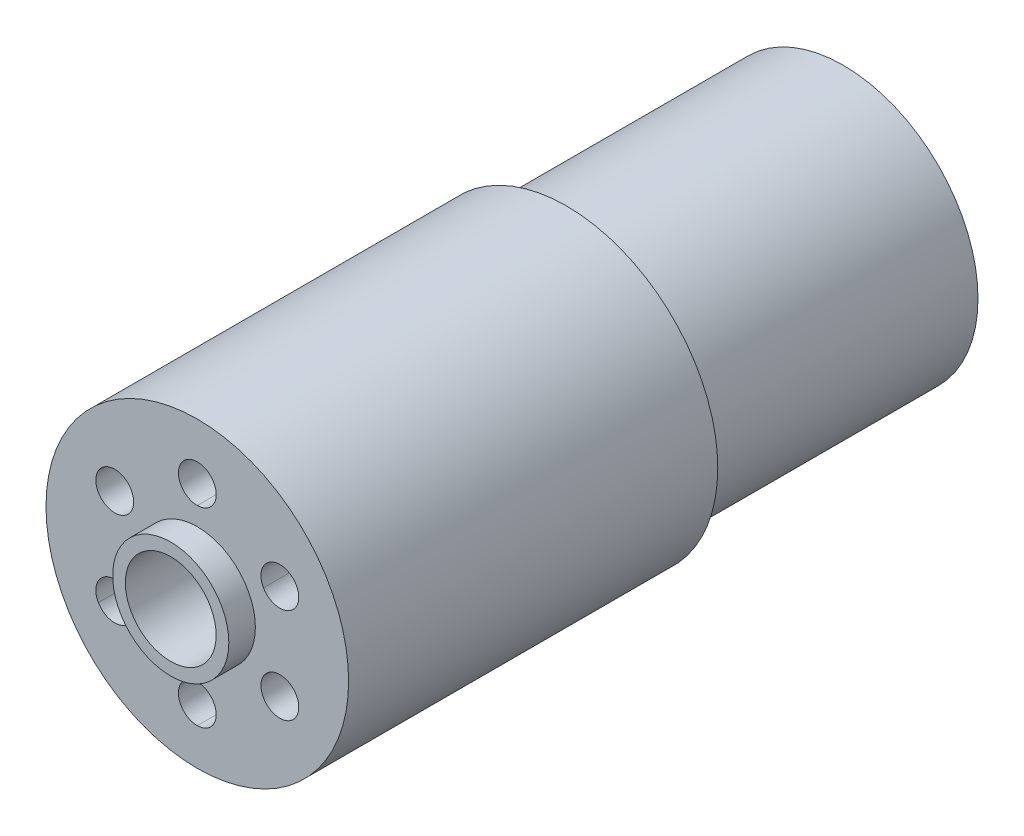
from build123d import *

# Parameters (mm, degrees)
SKETCH1_R           = 25.4
BOSS_EXTRUDE2_DEPTH = 108.458
SKETCH6_R           = 7.62
SKETCH6_R_2         = 3.175
CUT_EXTRUDE1_DEPTH  = 108.458
SKETCH7_R           = 25.4
SKETCH7_R_2         = 22.606
CUT_EXTRUDE2_DEPTH  = 46.482
SKETCH8_R           = 9.75
SKETCH8_R_2         = 7.62
BOSS_EXTRUDE7_DEPTH = 4.4577
BOSS_EXTRUDE8_START = 4.4577
SKETCH9_R           = 9.75
SKETCH9_R_2         = 7.62
BOSS_EXTRUDE8_DEPTH = 4.4577


with BuildPart() as part:
    # Sketch1 → Boss-Extrude2 (new body)
    with BuildSketch(Plane.XY):
        Circle(SKETCH1_R)
    extrude(amount=BOSS_EXTRUDE2_DEPTH)

    # Sketch6 → Cut-Extrude1 (cut)
    with BuildSketch(Plane(origin=(0, 0, 0), x_dir=(-1, 0, 0), z_dir=(0, 0, -1))):
        Circle(SKETCH6_R)
        with Locations((-13.858138511, 8.001)):
            Circle(SKETCH6_R_2)
        with Locations((0, 16.002)):
            Circle(SKETCH6_R_2)
        with Locations((13.858138511, 8.001)):
            Circle(SKETCH6_R_2)
        with Locations((13.858138511, -8.001)):
            Circle(SKETCH6_R_2)
        with Locations((0, -16.002)):
            Circle(SKETCH6_R_2)
        with Locations((-13.858138511, -8.001)):
            Circle(SKETCH6_R_2)
    extrude(amount=-CUT_EXTRUDE1_DEPTH, mode=Mode.SUBTRACT)

    # Sketch7 → Cut-Extrude2 (cut)
    with BuildSketch(Plane(origin=(0, 0, 0), x_dir=(-1, 0, 0), z_dir=(0, 0, -1))):
        Circle(SKETCH7_R)
        Circle(SKETCH7_R_2, mode=Mode.SUBTRACT)
    extrude(amount=-CUT_EXTRUDE2_DEPTH, mode=Mode.SUBTRACT)

    # Sketch8 → Boss-Extrude7 (add)
    with BuildSketch(Plane.XY.offset(108.458)):
        Circle(SKETCH8_R)
        Circle(SKETCH8_R_2, mode=Mode.SUBTRACT)
    extrude(amount=BOSS_EXTRUDE7_DEPTH)

    # Sketch9 → Boss-Extrude8 (add)
    with BuildSketch(Plane(origin=(0, 0, 0), x_dir=(-1, 0, 0), z_dir=(0, 0, -1)).offset(BOSS_EXTRUDE8_START)):
        Circle(SKETCH9_R)
        Circle(SKETCH9_R_2, mode=Mode.SUBTRACT)
    extrude(amount=-BOSS_EXTRUDE8_DEPTH)


solid = part.part
